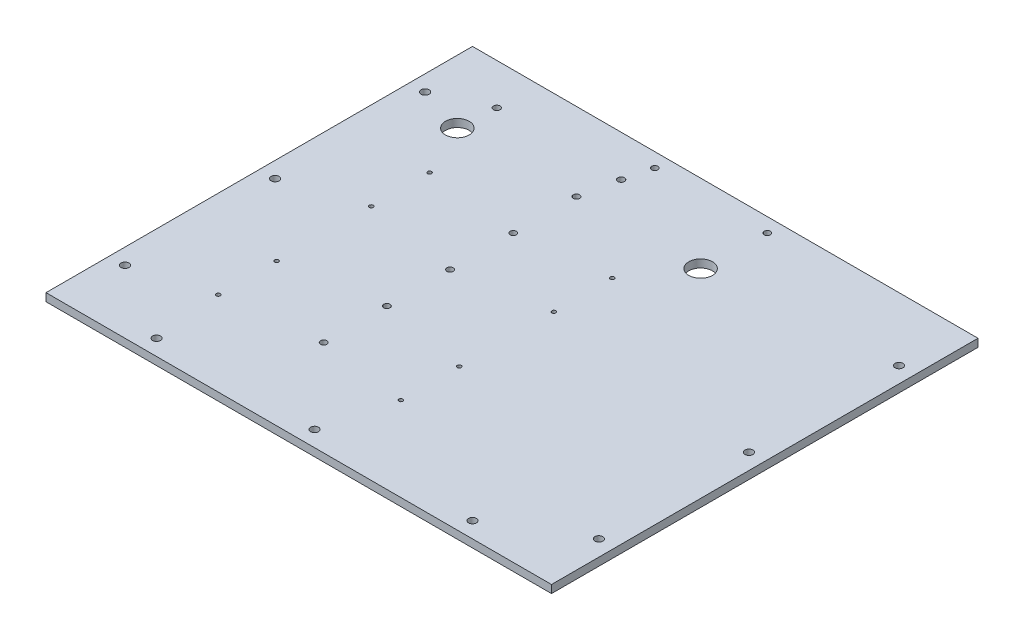
from build123d import *

# Parameters (mm, degrees)
SKETCH1_W           = 406.4
SKETCH1_H           = 342.9
BOSS_EXTRUDE1_DEPTH = 6.35
SKETCH3_R           = 3.175
CUT_EXTRUDE1_DEPTH  = 532.772218624
SKETCH4_R           = 9.525
SKETCH4_R_2         = 1.5875
SKETCH4_R_3         = 2.5
SKETCH4_R_4         = 2.667
SKETCH4_R_5         = 2.54
CUT_EXTRUDE2_DEPTH  = 532.772218624


with BuildPart() as part:
    # Sketch1 → Boss-Extrude1 (new body)
    with BuildSketch(Plane(origin=(0, 0, 0), x_dir=(1, 0, 0), z_dir=(0, 1, 0))):
        with Locations((203.2, 171.45)):
            Rectangle(SKETCH1_W, SKETCH1_H)
    extrude(amount=BOSS_EXTRUDE1_DEPTH)

    # Sketch3 → Cut-Extrude1 (cut, through all)
    with BuildSketch(Plane(origin=(0, 6.35, 0), x_dir=(1, 0, 0), z_dir=(0, 1, 0))):
        with Locations((203.2, 12.7)):
            Circle(SKETCH3_R)
        with Locations((330.2, 12.7)):
            Circle(SKETCH3_R)
        with Locations((76.2, 12.7)):
            Circle(SKETCH3_R)
        with Locations((12.7, 171.45)):
            Circle(SKETCH3_R)
        with Locations((393.7, 171.45)):
            Circle(SKETCH3_R)
        with Locations((12.7, 292.1)):
            Circle(SKETCH3_R)
        with Locations((12.7, 50.8)):
            Circle(SKETCH3_R)
        with Locations((393.7, 50.8)):
            Circle(SKETCH3_R)
        with Locations((393.7, 292.1)):
            Circle(SKETCH3_R)
    extrude(amount=-CUT_EXTRUDE1_DEPTH, mode=Mode.SUBTRACT)

    # Sketch4 → Cut-Extrude2 (cut, through all)
    with BuildSketch(Plane(origin=(0, 6.35, 0), x_dir=(1, 0, 0), z_dir=(0, 1, 0))):
        with Locations((246.4, 279.9)):
            Circle(SKETCH4_R)
        with Locations((50.8, 279.9)):
            Circle(SKETCH4_R)
        with Locations((217.5002, 67.7926)):
            Circle(SKETCH4_R_2)
        with Locations((217.5002, 114.7318)):
            Circle(SKETCH4_R_2)
        with Locations((70.6628, 114.7318)):
            Circle(SKETCH4_R_2)
        with Locations((70.6628, 67.7926)):
            Circle(SKETCH4_R_2)
        with Locations((70.6628, 190.8226)):
            Circle(SKETCH4_R_2)
        with Locations((70.6628, 237.7618)):
            Circle(SKETCH4_R_2)
        with Locations((217.5002, 237.7618)):
            Circle(SKETCH4_R_2)
        with Locations((217.5002, 190.8226)):
            Circle(SKETCH4_R_2)
        with Locations((248.4501, 331.47)):
            Circle(SKETCH4_R_3)
        with Locations((157.9499, 331.47)):
            Circle(SKETCH4_R_3)
        with Locations((52.5398, 309.88)):
            Circle(SKETCH4_R_4)
        with Locations((152.5398, 309.88)):
            Circle(SKETCH4_R_4)
        with Locations((146.3548, 178.4985)):
            Circle(SKETCH4_R_5)
        with Locations((146.3548, 127.6985)):
            Circle(SKETCH4_R_5)
        with Locations((146.3548, 76.8985)):
            Circle(SKETCH4_R_5)
        with Locations((146.3548, 280.0985)):
            Circle(SKETCH4_R_5)
        with Locations((146.3548, 229.2985)):
            Circle(SKETCH4_R_5)
    extrude(amount=-CUT_EXTRUDE2_DEPTH, mode=Mode.SUBTRACT)


solid = part.part
